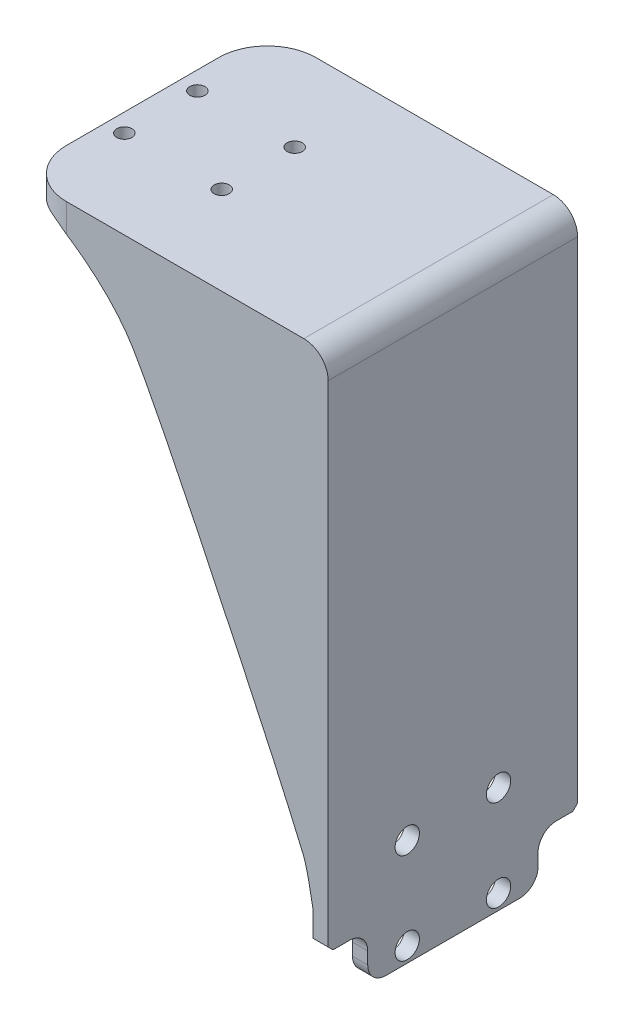
from build123d import *

# Parameters (mm, degrees)
SKETCH_1_W          = 51
SKETCH_1_H          = 41
SKETCH_1_R          = 1.25
EXTRUDE_1_DEPTH     = 3.4
SKETCH_2_R          = 1
EXTRUDE_2_DEPTH     = 2.5
EXTRUDE_4_DEPTH     = 2
FILLET_1_R          = 8
FILLET_2_R          = 4
SKETCH_6_R          = 2
CUT_EXTRUDE_2_DEPTH = 4
CUT_EXTRUDE_3_DEPTH = 4
FILLET_3_R          = 3
SKETCH_9_R          = 2
CUT_EXTRUDE_4_DEPTH = 4
SKETCH_10_R         = 2.5
CUT_EXTRUDE_5_DEPTH = 1.4
CHAMFER_1_SIZE      = 0.8
FILLET_4_R          = 4
FILLET_5_R          = 5


with BuildPart() as part:
    # 草图1 → 凸台-拉伸1 (new body)
    with BuildSketch(Plane(origin=(0, 0, 0), x_dir=(1, 0, 0), z_dir=(0, 1, 0))):
        Rectangle(SKETCH_1_W, SKETCH_1_H)
        with Locations((-22.5, 6)):
            Circle(SKETCH_1_R, mode=Mode.SUBTRACT)
        with Locations((-22.5, -6)):
            Circle(SKETCH_1_R, mode=Mode.SUBTRACT)
        with Locations((-6.5, 6)):
            Circle(SKETCH_1_R, mode=Mode.SUBTRACT)
        with Locations((-6.5, -6)):
            Circle(SKETCH_1_R, mode=Mode.SUBTRACT)
    extrude(amount=EXTRUDE_1_DEPTH)

    # 草图2 → 凸台-拉伸2 (add)
    with BuildSketch(Plane(origin=(25.5, 0, 0), x_dir=(0, 0, -1), z_dir=(1, 0, 0))):
        Polygon((-20.5, 0), (20.5, 0), (20.5, -90), (10.637668918, -90), (-20.5, -90), align=None)
        with Locations((-7.5, -87.5)):
            Circle(SKETCH_2_R, mode=Mode.SUBTRACT)
        with Locations((7.5, -87.5)):
            Circle(SKETCH_2_R, mode=Mode.SUBTRACT)
        with Locations((7.5, -72.5)):
            Circle(SKETCH_2_R, mode=Mode.SUBTRACT)
        with Locations((-7.5, -72.5)):
            Circle(SKETCH_2_R, mode=Mode.SUBTRACT)
    extrude(amount=-EXTRUDE_2_DEPTH)

    # 草图5 → 凸台-拉伸4 (add)
    with BuildSketch(Plane(origin=(0, 0, -20.5), x_dir=(-1, 0, 0), z_dir=(0, 0, -1))):
        with BuildLine():
            Line((-25.5, 3.4), (19.5, 3.4))
            Line((19.5, 3.4), (19.5, 0))
            add(Edge.make_bspline(
                [(19.5, 0), (10.67122189, -5.3692624), (2.779429236, -18.193392293), (-17.74050095, -61.459973359), (-22.103142794, -71.739554525), (-23, -77)],
                knots=[0, 0, 0, 0.396049025, 0.788579615, 0.966137571, 1, 1, 1], degree=2))
            Line((-23, -77), (-25.5, -77))
            Line((-25.5, -77), (-25.5, 3.4))
        make_face()
    extrude_4 = extrude(amount=-EXTRUDE_4_DEPTH)

    # 镜向3: 凸台-拉伸4 across plane
    add(extrude_4.mirror(Plane.XY))

    # 圆角1
    fillet_1_edges = [part.edges().sort_by_distance(p)[0] for p in [
        (-25.5, 1.7, -20.5),
        (-25.5, 1.7, 20.5),
    ]]
    fillet(fillet_1_edges, radius=FILLET_1_R)

    # 圆角2
    fillet_2_edges = [part.edges().sort_by_distance(p)[0] for p in [
        (23, 0, 0),
        (25.5, 3.4, 0),
    ]]
    fillet(fillet_2_edges, radius=FILLET_2_R)

    # 草图6 → 切除-拉伸2 (cut)
    with BuildSketch(Plane.ZY.offset(-23)):
        with Locations((7.5, -87.5)):
            Circle(SKETCH_6_R)
        with Locations((-7.5, -87.5)):
            Circle(SKETCH_6_R)
    extrude(amount=-CUT_EXTRUDE_2_DEPTH, mode=Mode.SUBTRACT)

    # 草图8 → 切除-拉伸3 (cut)
    with BuildSketch(Plane(origin=(25.5, 0, 0), x_dir=(0, 0, -1), z_dir=(1, 0, 0))):
        Polygon((14, -102.818047241), (14, -82), (23.468492482, -82), (23.468492482, -110.008191191), (-23.468492482, -110.008191191), (-23.468492482, -82), (-14, -82), (-14, -102.818047241), align=None)
    extrude(amount=-CUT_EXTRUDE_3_DEPTH, mode=Mode.SUBTRACT)

    # 圆角3
    fillet_3_edges = [part.edges().sort_by_distance(p)[0] for p in [
        (24.25, -90, -14),
        (24.25, -82, -14),
        (24.25, -82, 14),
        (24.25, -90, 14),
    ]]
    fillet(fillet_3_edges, radius=FILLET_3_R)

    # 草图9 → 切除-拉伸4 (cut)
    with BuildSketch(Plane.ZY.offset(-23)):
        with Locations((7.5, -72.5)):
            Circle(SKETCH_9_R)
        with Locations((-7.5, -72.5)):
            Circle(SKETCH_9_R)
    extrude(amount=-CUT_EXTRUDE_4_DEPTH, mode=Mode.SUBTRACT)

    # 草图10 → 切除-拉伸5 (cut)
    with BuildSketch(Plane(origin=(0, 0, 0), x_dir=(-1, 0, 0), z_dir=(0, -1, 0))):
        with Locations((6.5, -6)):
            Circle(SKETCH_10_R)
        with Locations((22.5, -6)):
            Circle(SKETCH_10_R)
        with Locations((6.5, 6)):
            Circle(SKETCH_10_R)
        with Locations((22.5, 6)):
            Circle(SKETCH_10_R)
    extrude(amount=-CUT_EXTRUDE_5_DEPTH, mode=Mode.SUBTRACT)

    # 倒角1
    chamfer_1_edges = [part.edges().sort_by_distance(p)[0] for p in [
        (24.25, -82, 20.5),
        (24.25, -82, -20.5),
    ]]
    chamfer(chamfer_1_edges, length=CHAMFER_1_SIZE)

    # 圆角4
    fillet_4_edges = [part.edges().sort_by_distance(p)[0] for p in [
        (-0.25, 0, -18.5),
        (21.828427125, -1.171572875, -18.5),
        (-0.25, 0, 18.5),
        (21.828427125, -1.171572875, 18.5),
        (23, -40.5, -18.5),
        (23, -40.5, 18.5),
    ]]
    fillet(fillet_4_edges, radius=FILLET_4_R)

    # 圆角5
    fillet_5_edges = [part.edges().sort_by_distance(p)[0] for p in [
        (-19.5, 0, 16.5),
        (-19.5, 0, -16.5),
    ]]
    fillet(fillet_5_edges, radius=FILLET_5_R)


solid = part.part
